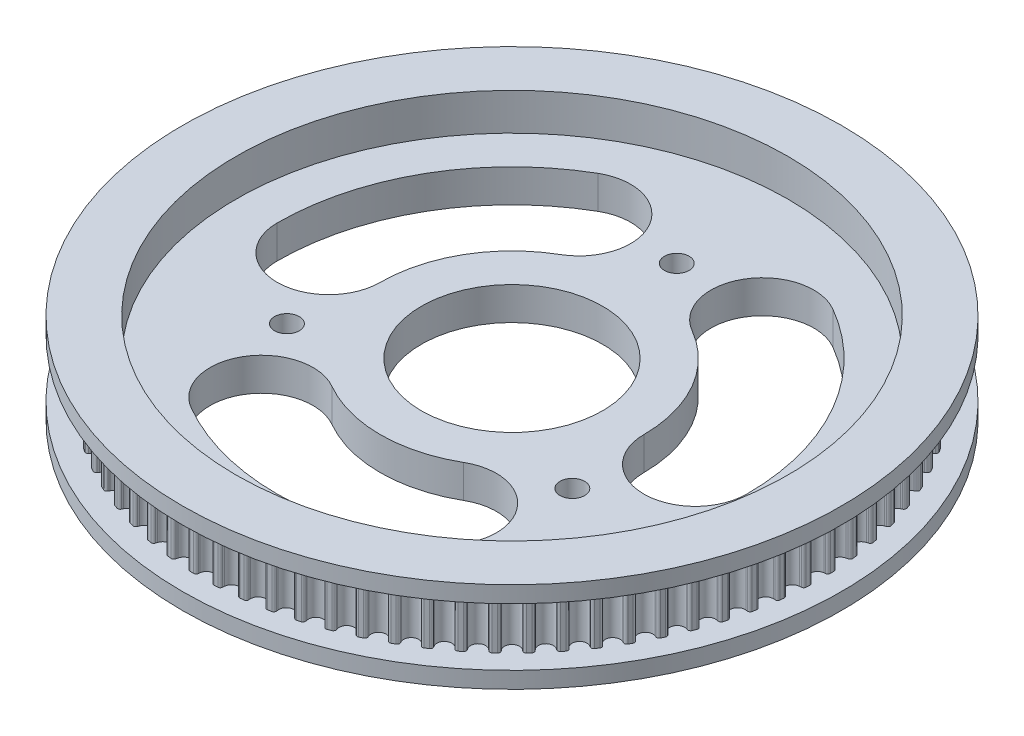
from build123d import *

# Parameters (mm, degrees)
SKETCH_1_R          = 40
EXTRUDE_1_DEPTH     = 5.5
SKETCH_2_OUTSIDE_W  = 104.734
SKETCH_2_OUTSIDE_H  = 104.734
CUT_EXTRUDE_1_DEPTH = 3.5
SKETCH_3_R          = 11
SKETCH_3_R_2        = 1.5
CUT_EXTRUDE_2_DEPTH = 58.628118137
CUT_EXTRUDE_START   = 2.5
SKETCH_4_R          = 33.5
SKETCH_4_R_2        = 11
CUT_EXTRUDE_3_DEPTH = 2.5
CUT_EXTRUDE_4_DEPTH = 58.203583804
SKETCH_6_R          = 33.5
CUT_EXTRUDE_5_DEPTH = 4.5


with BuildPart() as part:
    # 草图1 → 凸台-拉伸1 (new, symmetric)
    with BuildSketch(Plane(origin=(0, 0, 0), x_dir=(1, 0, 0), z_dir=(0, 1, 0))):
        with Locations(Location((0, 0, 0), (0, 0, 270))):
            Circle(SKETCH_1_R)
    extrude(amount=EXTRUDE_1_DEPTH, both=True)

    # 草图2 outside → 切除-拉伸1 (cut, symmetric)
    with BuildSketch(Plane(origin=(0, 0, 0), x_dir=(1, 0, 0), z_dir=(0, 1, 0))):
        Rectangle(SKETCH_2_OUTSIDE_W, SKETCH_2_OUTSIDE_H)
        with BuildLine():
            Line((-0.927435551, 37.150343182), (-0.903216998, 36.953098898))
            ThreePointArc((-0.903216998, 36.953098898), (0, 36.154), (0.903216998, 36.953098898))
            Line((0.903216998, 36.953098898), (0.927435551, 37.150343182))
            ThreePointArc((0.927435551, 37.150343182), (1.030147603, 37.34171833), (1.235097598, 37.413619043))
            ThreePointArc((1.235097598, 37.413619043), (1.469651943, 37.405139743), (1.704148514, 37.395189983))
            ThreePointArc((1.704148514, 37.395189983), (1.902825451, 37.307430724), (1.990205755, 37.108586826))
            Line((1.990205755, 37.108586826), (1.998874042, 36.910050415))
            ThreePointArc((1.998874042, 36.910050415), (2.836610147, 36.042549284), (3.799739405, 36.768319237))
            Line((3.799739405, 36.768319237), (3.839358909, 36.963055317))
            ThreePointArc((3.839358909, 36.963055317), (3.956769455, 37.145781825), (4.166728922, 37.201380701))
            ThreePointArc((4.166728922, 37.201380701), (4.399894936, 37.174524618), (4.632887983, 37.146207141))
            ThreePointArc((4.632887983, 37.146207141), (4.824066954, 37.043130401), (4.895576781, 36.838043694))
            Line((4.895576781, 36.838043694), (4.88864136, 36.639439198))
            ThreePointArc((4.88864136, 36.639439198), (5.655731649, 35.708884266), (6.672835156, 36.356850662))
            Line((6.672835156, 36.356850662), (6.727611342, 36.547877925))
            ThreePointArc((6.727611342, 36.547877925), (6.858996507, 36.720829223), (7.072670977, 36.759783477))
            ThreePointArc((7.072670977, 36.759783477), (7.303011114, 36.714716187), (7.533064158, 36.668205579))
            ThreePointArc((7.533064158, 36.668205579), (7.71556648, 36.550446862), (7.770764949, 36.340381772))
            Line((7.770764949, 36.340381772), (7.748268577, 36.142933654))
            ThreePointArc((7.748268577, 36.142933654), (8.439983685, 35.155062102), (9.504790658, 35.721230013))
            Line((9.504790658, 35.721230013), (9.574385814, 35.907370713))
            ThreePointArc((9.574385814, 35.907370713), (9.718935565, 36.069480498), (9.935007664, 36.091549963))
            ThreePointArc((9.935007664, 36.091549963), (10.1611018, 36.028549321), (10.386796487, 35.964132337))
            ThreePointArc((10.386796487, 35.964132337), (10.559496973, 35.832417663), (10.598043766, 35.618669312))
            Line((10.598043766, 35.618669312), (10.560125143, 35.423594906))
            ThreePointArc((10.560125143, 35.423594906), (11.172200415, 34.38449729), (12.278145966, 34.865376102))
            Line((12.278145966, 34.865376102), (12.362131014, 35.045482619))
            ThreePointArc((12.362131014, 35.045482619), (12.518954154, 35.195751431), (12.736091724, 35.200800042))
            ThreePointArc((12.736091724, 35.200800042), (12.956545915, 35.120254469), (13.176490761, 35.038328259))
            ThreePointArc((13.176490761, 35.038328259), (13.338324655, 34.893469694), (13.359982119, 34.677355911))
            Line((13.359982119, 34.677355911), (13.306875025, 34.485857915))
            ThreePointArc((13.306875025, 34.485857915), (13.835536814, 33.401940618), (14.97580242, 33.794565553))
            Line((14.97580242, 33.794565553), (15.073659565, 33.967527471))
            ThreePointArc((15.073659565, 33.967527471), (15.241789227, 34.105028853), (15.458653544, 34.093025483))
            ThreePointArc((15.458653544, 34.093025483), (15.672108615, 33.995431569), (15.884947589, 33.896501237))
            ThreePointArc((15.884947589, 33.896501237), (16.034917131, 33.739391881), (16.03955174, 33.52224508))
            Line((16.03955174, 33.52224508), (15.971583597, 33.335504143))
            ThreePointArc((15.971583597, 33.335504143), (16.413572528, 32.213449876), (17.581128073, 32.51540027))
            Line((17.581128073, 32.51540027), (17.692253993, 32.680151221))
            ThreePointArc((17.692253993, 32.680151221), (17.870653601, 32.804037431), (18.085907624, 32.775056085))
            ThreePointArc((18.085907624, 32.775056085), (18.291047554, 32.661015529), (18.495468432, 32.545691012))
            ThreePointArc((18.495468432, 32.545691012), (18.63264901, 32.377299498), (18.620232191, 32.16045846))
            Line((18.620232191, 32.16045846), (18.537822046, 31.979625902))
            ThreePointArc((18.537822046, 31.979625902), (18.890413109, 30.826352502), (20.078060225, 31.035766732))
            Line((20.078060225, 31.035766732), (20.201769792, 31.191290972))
            ThreePointArc((20.201769792, 31.191290972), (20.389339453, 31.30079821), (20.60165607, 31.255017568))
            ThreePointArc((20.60165607, 31.255017568), (20.797216103, 31.125233467), (20.991958562, 30.99422578))
            ThreePointArc((20.991958562, 30.99422578), (21.115504412, 30.815590297), (21.086112718, 30.60039192))
            Line((21.086112718, 30.60039192), (20.989768657, 30.426582634))
            ThreePointArc((20.989768657, 30.426582634), (21.250788011, 29.249200415), (22.451204459, 29.364787372))
            Line((22.451204459, 29.364787372), (22.586734961, 29.510126042))
            ThreePointArc((22.586734961, 29.510126042), (22.782318247, 29.604579159), (22.990388455, 29.542281474))
            ThreePointArc((22.990388455, 29.542281474), (23.175162898, 29.397553991), (23.359026287, 29.25167084))
            ThreePointArc((23.359026287, 29.25167084), (23.468175708, 29.063892734), (23.421990349, 28.851663788))
            Line((23.421990349, 28.851663788), (23.312306365, 28.685949366))
            ThreePointArc((23.312306365, 28.685949366), (23.480144739, 27.49171728), (24.685929552, 27.512764333))
            Line((24.685929552, 27.512764333), (24.8324454, 27.647021371))
            ThreePointArc((24.8324454, 27.647021371), (25.034836473, 27.725838034), (25.23737745, 27.647407391))
            ThreePointArc((25.23737745, 27.647407391), (25.410227108, 27.488628818), (25.582077847, 27.328769621))
            ThreePointArc((25.582077847, 27.328769621), (25.676157897, 27.133006608), (25.61346362, 26.925055554))
            Line((25.61346362, 26.925055554), (25.491115952, 26.76845768))
            ThreePointArc((25.491115952, 26.76845768), (25.564738567, 25.564738567), (26.76845768, 25.491115952))
            Line((26.76845768, 25.491115952), (26.925055554, 25.61346362))
            ThreePointArc((26.925055554, 25.61346362), (27.133006608, 25.676157897), (27.328769621, 25.582077847))
            ThreePointArc((27.328769621, 25.582077847), (27.488628818, 25.410227108), (27.647407391, 25.23737745))
            ThreePointArc((27.647407391, 25.23737745), (27.725838034, 25.034836473), (27.647021371, 24.8324454))
            Line((27.647021371, 24.8324454), (27.512764333, 24.685929552))
            ThreePointArc((27.512764333, 24.685929552), (27.49171728, 23.480144739), (28.685949366, 23.312306365))
            Line((28.685949366, 23.312306365), (28.851663788, 23.421990349))
            ThreePointArc((28.851663788, 23.421990349), (29.063892734, 23.468175708), (29.25167084, 23.359026287))
            ThreePointArc((29.25167084, 23.359026287), (29.397553991, 23.175162898), (29.542281474, 22.990388455))
            ThreePointArc((29.542281474, 22.990388455), (29.604579159, 22.782318247), (29.510126042, 22.586734961))
            Line((29.510126042, 22.586734961), (29.364787372, 22.451204459))
            ThreePointArc((29.364787372, 22.451204459), (29.249200415, 21.250788011), (30.426582634, 20.989768657))
            Line((30.426582634, 20.989768657), (30.60039192, 21.086112718))
            ThreePointArc((30.60039192, 21.086112718), (30.815590297, 21.115504412), (30.99422578, 20.991958562))
            ThreePointArc((30.99422578, 20.991958562), (31.125233467, 20.797216103), (31.255017568, 20.60165607))
            ThreePointArc((31.255017568, 20.60165607), (31.30079821, 20.389339453), (31.191290972, 20.201769792))
            Line((31.191290972, 20.201769792), (31.035766732, 20.078060225))
            ThreePointArc((31.035766732, 20.078060225), (30.826352502, 18.890413109), (31.979625902, 18.537822046))
            Line((31.979625902, 18.537822046), (32.16045846, 18.620232191))
            ThreePointArc((32.16045846, 18.620232191), (32.377299498, 18.63264901), (32.545691012, 18.495468432))
            ThreePointArc((32.545691012, 18.495468432), (32.661015529, 18.291047554), (32.775056085, 18.085907624))
            ThreePointArc((32.775056085, 18.085907624), (32.804037431, 17.870653601), (32.680151221, 17.692253993))
            Line((32.680151221, 17.692253993), (32.51540027, 17.581128073))
            ThreePointArc((32.51540027, 17.581128073), (32.213449876, 16.413572528), (33.335504143, 15.971583597))
            Line((33.335504143, 15.971583597), (33.52224508, 16.03955174))
            ThreePointArc((33.52224508, 16.03955174), (33.739391881, 16.034917131), (33.896501237, 15.884947589))
            ThreePointArc((33.896501237, 15.884947589), (33.995431569, 15.672108615), (34.093025483, 15.458653544))
            ThreePointArc((34.093025483, 15.458653544), (34.105028853, 15.241789227), (33.967527471, 15.073659565))
            Line((33.967527471, 15.073659565), (33.794565553, 14.97580242))
            ThreePointArc((33.794565553, 14.97580242), (33.401940618, 13.835536814), (34.485857915, 13.306875025))
            Line((34.485857915, 13.306875025), (34.677355911, 13.359982119))
            ThreePointArc((34.677355911, 13.359982119), (34.893469694, 13.338324655), (35.038328259, 13.176490761))
            ThreePointArc((35.038328259, 13.176490761), (35.120254469, 12.956545915), (35.200800042, 12.736091724))
            ThreePointArc((35.200800042, 12.736091724), (35.195751431, 12.518954154), (35.045482619, 12.362131014))
            Line((35.045482619, 12.362131014), (34.865376102, 12.278145966))
            ThreePointArc((34.865376102, 12.278145966), (34.38449729, 11.172200415), (35.423594906, 10.560125143))
            Line((35.423594906, 10.560125143), (35.618669312, 10.598043766))
            ThreePointArc((35.618669312, 10.598043766), (35.832417663, 10.559496973), (35.964132337, 10.386796487))
            ThreePointArc((35.964132337, 10.386796487), (36.028549321, 10.1611018), (36.091549963, 9.935007664))
            ThreePointArc((36.091549963, 9.935007664), (36.069480498, 9.718935565), (35.907370713, 9.574385814))
            Line((35.907370713, 9.574385814), (35.721230013, 9.504790658))
            ThreePointArc((35.721230013, 9.504790658), (35.155062102, 8.439983685), (36.142933654, 7.748268577))
            Line((36.142933654, 7.748268577), (36.340381772, 7.770764949))
            ThreePointArc((36.340381772, 7.770764949), (36.550446862, 7.71556648), (36.668205579, 7.533064158))
            ThreePointArc((36.668205579, 7.533064158), (36.714716187, 7.303011114), (36.759783477, 7.072670977))
            ThreePointArc((36.759783477, 7.072670977), (36.720829223, 6.858996507), (36.547877925, 6.727611342))
            Line((36.547877925, 6.727611342), (36.356850662, 6.672835156))
            ThreePointArc((36.356850662, 6.672835156), (35.708884266, 5.655731649), (36.639439198, 4.88864136))
            Line((36.639439198, 4.88864136), (36.838043694, 4.895576781))
            ThreePointArc((36.838043694, 4.895576781), (37.043130401, 4.824066954), (37.146207141, 4.632887983))
            ThreePointArc((37.146207141, 4.632887983), (37.174524618, 4.399894936), (37.201380701, 4.166728922))
            ThreePointArc((37.201380701, 4.166728922), (37.145781825, 3.956769455), (36.963055317, 3.839358909))
            Line((36.963055317, 3.839358909), (36.768319237, 3.799739405))
            ThreePointArc((36.768319237, 3.799739405), (36.042549284, 2.836610147), (36.910050415, 1.998874042))
            Line((36.910050415, 1.998874042), (37.108586826, 1.990205755))
            ThreePointArc((37.108586826, 1.990205755), (37.307430724, 1.902825451), (37.395189983, 1.704148514))
            ThreePointArc((37.395189983, 1.704148514), (37.405139743, 1.469651943), (37.413619043, 1.235097598))
            ThreePointArc((37.413619043, 1.235097598), (37.34171833, 1.030147603), (37.150343182, 0.927435551))
            Line((37.150343182, 0.927435551), (36.953098898, 0.903216998))
            ThreePointArc((36.953098898, 0.903216998), (36.154, 0), (36.953098898, -0.903216998))
            Line((36.953098898, -0.903216998), (37.150343182, -0.927435551))
            ThreePointArc((37.150343182, -0.927435551), (37.34171833, -1.030147603), (37.413619043, -1.235097598))
            ThreePointArc((37.413619043, -1.235097598), (37.405139743, -1.469651943), (37.395189983, -1.704148514))
            ThreePointArc((37.395189983, -1.704148514), (37.307430724, -1.902825451), (37.108586826, -1.990205755))
            Line((37.108586826, -1.990205755), (36.910050415, -1.998874042))
            ThreePointArc((36.910050415, -1.998874042), (36.042549284, -2.836610147), (36.768319237, -3.799739405))
            Line((36.768319237, -3.799739405), (36.963055317, -3.839358909))
            ThreePointArc((36.963055317, -3.839358909), (37.145781825, -3.956769455), (37.201380701, -4.166728922))
            ThreePointArc((37.201380701, -4.166728922), (37.174524618, -4.399894936), (37.146207141, -4.632887983))
            ThreePointArc((37.146207141, -4.632887983), (37.043130401, -4.824066954), (36.838043694, -4.895576781))
            Line((36.838043694, -4.895576781), (36.639439198, -4.88864136))
            ThreePointArc((36.639439198, -4.88864136), (35.708884266, -5.655731649), (36.356850662, -6.672835156))
            Line((36.356850662, -6.672835156), (36.547877925, -6.727611342))
            ThreePointArc((36.547877925, -6.727611342), (36.720829223, -6.858996507), (36.759783477, -7.072670977))
            ThreePointArc((36.759783477, -7.072670977), (36.714716187, -7.303011114), (36.668205579, -7.533064158))
            ThreePointArc((36.668205579, -7.533064158), (36.550446862, -7.71556648), (36.340381772, -7.770764949))
            Line((36.340381772, -7.770764949), (36.142933654, -7.748268577))
            ThreePointArc((36.142933654, -7.748268577), (35.155062102, -8.439983685), (35.721230013, -9.504790658))
            Line((35.721230013, -9.504790658), (35.907370713, -9.574385814))
            ThreePointArc((35.907370713, -9.574385814), (36.069480498, -9.718935565), (36.091549963, -9.935007664))
            ThreePointArc((36.091549963, -9.935007664), (36.028549321, -10.1611018), (35.964132337, -10.386796487))
            ThreePointArc((35.964132337, -10.386796487), (35.832417663, -10.559496973), (35.618669312, -10.598043766))
            Line((35.618669312, -10.598043766), (35.423594906, -10.560125143))
            ThreePointArc((35.423594906, -10.560125143), (34.38449729, -11.172200415), (34.865376102, -12.278145966))
            Line((34.865376102, -12.278145966), (35.045482619, -12.362131014))
            ThreePointArc((35.045482619, -12.362131014), (35.195751431, -12.518954154), (35.200800042, -12.736091724))
            ThreePointArc((35.200800042, -12.736091724), (35.120254469, -12.956545915), (35.038328259, -13.176490761))
            ThreePointArc((35.038328259, -13.176490761), (34.893469694, -13.338324655), (34.677355911, -13.359982119))
            Line((34.677355911, -13.359982119), (34.485857915, -13.306875025))
            ThreePointArc((34.485857915, -13.306875025), (33.401940618, -13.835536814), (33.794565553, -14.97580242))
            Line((33.794565553, -14.97580242), (33.967527471, -15.073659565))
            ThreePointArc((33.967527471, -15.073659565), (34.105028853, -15.241789227), (34.093025483, -15.458653544))
            ThreePointArc((34.093025483, -15.458653544), (33.995431569, -15.672108615), (33.896501237, -15.884947589))
            ThreePointArc((33.896501237, -15.884947589), (33.739391881, -16.034917131), (33.52224508, -16.03955174))
            Line((33.52224508, -16.03955174), (33.335504143, -15.971583597))
            ThreePointArc((33.335504143, -15.971583597), (32.213449876, -16.413572528), (32.51540027, -17.581128073))
            Line((32.51540027, -17.581128073), (32.680151221, -17.692253993))
            ThreePointArc((32.680151221, -17.692253993), (32.804037431, -17.870653601), (32.775056085, -18.085907624))
            ThreePointArc((32.775056085, -18.085907624), (32.661015529, -18.291047554), (32.545691012, -18.495468432))
            ThreePointArc((32.545691012, -18.495468432), (32.377299498, -18.63264901), (32.16045846, -18.620232191))
            Line((32.16045846, -18.620232191), (31.979625902, -18.537822046))
            ThreePointArc((31.979625902, -18.537822046), (30.826352502, -18.890413109), (31.035766732, -20.078060225))
            Line((31.035766732, -20.078060225), (31.191290972, -20.201769792))
            ThreePointArc((31.191290972, -20.201769792), (31.30079821, -20.389339453), (31.255017568, -20.60165607))
            ThreePointArc((31.255017568, -20.60165607), (31.125233467, -20.797216103), (30.99422578, -20.991958562))
            ThreePointArc((30.99422578, -20.991958562), (30.815590297, -21.115504412), (30.60039192, -21.086112718))
            Line((30.60039192, -21.086112718), (30.426582634, -20.989768657))
            ThreePointArc((30.426582634, -20.989768657), (29.249200415, -21.250788011), (29.364787372, -22.451204459))
            Line((29.364787372, -22.451204459), (29.510126042, -22.586734961))
            ThreePointArc((29.510126042, -22.586734961), (29.604579159, -22.782318247), (29.542281474, -22.990388455))
            ThreePointArc((29.542281474, -22.990388455), (29.397553991, -23.175162898), (29.25167084, -23.359026287))
            ThreePointArc((29.25167084, -23.359026287), (29.063892734, -23.468175708), (28.851663788, -23.421990349))
            Line((28.851663788, -23.421990349), (28.685949366, -23.312306365))
            ThreePointArc((28.685949366, -23.312306365), (27.49171728, -23.480144739), (27.512764333, -24.685929552))
            Line((27.512764333, -24.685929552), (27.647021371, -24.8324454))
            ThreePointArc((27.647021371, -24.8324454), (27.725838034, -25.034836473), (27.647407391, -25.23737745))
            ThreePointArc((27.647407391, -25.23737745), (27.488628818, -25.410227108), (27.328769621, -25.582077847))
            ThreePointArc((27.328769621, -25.582077847), (27.133006608, -25.676157897), (26.925055554, -25.61346362))
            Line((26.925055554, -25.61346362), (26.76845768, -25.491115952))
            ThreePointArc((26.76845768, -25.491115952), (25.564738567, -25.564738567), (25.491115952, -26.76845768))
            Line((25.491115952, -26.76845768), (25.61346362, -26.925055554))
            ThreePointArc((25.61346362, -26.925055554), (25.676157897, -27.133006608), (25.582077847, -27.328769621))
            ThreePointArc((25.582077847, -27.328769621), (25.410227108, -27.488628818), (25.23737745, -27.647407391))
            ThreePointArc((25.23737745, -27.647407391), (25.034836473, -27.725838034), (24.8324454, -27.647021371))
            Line((24.8324454, -27.647021371), (24.685929552, -27.512764333))
            ThreePointArc((24.685929552, -27.512764333), (23.480144739, -27.49171728), (23.312306365, -28.685949366))
            Line((23.312306365, -28.685949366), (23.421990349, -28.851663788))
            ThreePointArc((23.421990349, -28.851663788), (23.468175708, -29.063892734), (23.359026287, -29.25167084))
            ThreePointArc((23.359026287, -29.25167084), (23.175162898, -29.397553991), (22.990388455, -29.542281474))
            ThreePointArc((22.990388455, -29.542281474), (22.782318247, -29.604579159), (22.586734961, -29.510126042))
            Line((22.586734961, -29.510126042), (22.451204459, -29.364787372))
            ThreePointArc((22.451204459, -29.364787372), (21.250788011, -29.249200415), (20.989768657, -30.426582634))
            Line((20.989768657, -30.426582634), (21.086112718, -30.60039192))
            ThreePointArc((21.086112718, -30.60039192), (21.115504412, -30.815590297), (20.991958562, -30.99422578))
            ThreePointArc((20.991958562, -30.99422578), (20.797216103, -31.125233467), (20.60165607, -31.255017568))
            ThreePointArc((20.60165607, -31.255017568), (20.389339453, -31.30079821), (20.201769792, -31.191290972))
            Line((20.201769792, -31.191290972), (20.078060225, -31.035766732))
            ThreePointArc((20.078060225, -31.035766732), (18.890413109, -30.826352502), (18.537822046, -31.979625902))
            Line((18.537822046, -31.979625902), (18.620232191, -32.16045846))
            ThreePointArc((18.620232191, -32.16045846), (18.63264901, -32.377299498), (18.495468432, -32.545691012))
            ThreePointArc((18.495468432, -32.545691012), (18.291047554, -32.661015529), (18.085907624, -32.775056085))
            ThreePointArc((18.085907624, -32.775056085), (17.870653601, -32.804037431), (17.692253993, -32.680151221))
            Line((17.692253993, -32.680151221), (17.581128073, -32.51540027))
            ThreePointArc((17.581128073, -32.51540027), (16.413572528, -32.213449876), (15.971583597, -33.335504143))
            Line((15.971583597, -33.335504143), (16.03955174, -33.52224508))
            ThreePointArc((16.03955174, -33.52224508), (16.034917131, -33.739391881), (15.884947589, -33.896501237))
            ThreePointArc((15.884947589, -33.896501237), (15.672108615, -33.995431569), (15.458653544, -34.093025483))
            ThreePointArc((15.458653544, -34.093025483), (15.241789227, -34.105028853), (15.073659565, -33.967527471))
            Line((15.073659565, -33.967527471), (14.97580242, -33.794565553))
            ThreePointArc((14.97580242, -33.794565553), (13.835536814, -33.401940618), (13.306875025, -34.485857915))
            Line((13.306875025, -34.485857915), (13.359982119, -34.677355911))
            ThreePointArc((13.359982119, -34.677355911), (13.338324655, -34.893469694), (13.176490761, -35.038328259))
            ThreePointArc((13.176490761, -35.038328259), (12.956545915, -35.120254469), (12.736091724, -35.200800042))
            ThreePointArc((12.736091724, -35.200800042), (12.518954154, -35.195751431), (12.362131014, -35.045482619))
            Line((12.362131014, -35.045482619), (12.278145966, -34.865376102))
            ThreePointArc((12.278145966, -34.865376102), (11.172200415, -34.38449729), (10.560125143, -35.423594906))
            Line((10.560125143, -35.423594906), (10.598043766, -35.618669312))
            ThreePointArc((10.598043766, -35.618669312), (10.559496973, -35.832417663), (10.386796487, -35.964132337))
            ThreePointArc((10.386796487, -35.964132337), (10.1611018, -36.028549321), (9.935007664, -36.091549963))
            ThreePointArc((9.935007664, -36.091549963), (9.718935565, -36.069480498), (9.574385814, -35.907370713))
            Line((9.574385814, -35.907370713), (9.504790658, -35.721230013))
            ThreePointArc((9.504790658, -35.721230013), (8.439983685, -35.155062102), (7.748268577, -36.142933654))
            Line((7.748268577, -36.142933654), (7.770764949, -36.340381772))
            ThreePointArc((7.770764949, -36.340381772), (7.71556648, -36.550446862), (7.533064158, -36.668205579))
            ThreePointArc((7.533064158, -36.668205579), (7.303011114, -36.714716187), (7.072670977, -36.759783477))
            ThreePointArc((7.072670977, -36.759783477), (6.858996507, -36.720829223), (6.727611342, -36.547877925))
            Line((6.727611342, -36.547877925), (6.672835156, -36.356850662))
            ThreePointArc((6.672835156, -36.356850662), (5.655731649, -35.708884266), (4.88864136, -36.639439198))
            Line((4.88864136, -36.639439198), (4.895576781, -36.838043694))
            ThreePointArc((4.895576781, -36.838043694), (4.824066954, -37.043130401), (4.632887983, -37.146207141))
            ThreePointArc((4.632887983, -37.146207141), (4.399894936, -37.174524618), (4.166728922, -37.201380701))
            ThreePointArc((4.166728922, -37.201380701), (3.956769455, -37.145781825), (3.839358909, -36.963055317))
            Line((3.839358909, -36.963055317), (3.799739405, -36.768319237))
            ThreePointArc((3.799739405, -36.768319237), (2.836610147, -36.042549284), (1.998874042, -36.910050415))
            Line((1.998874042, -36.910050415), (1.990205755, -37.108586826))
            ThreePointArc((1.990205755, -37.108586826), (1.902825451, -37.307430724), (1.704148514, -37.395189983))
            ThreePointArc((1.704148514, -37.395189983), (1.469651943, -37.405139743), (1.235097598, -37.413619043))
            ThreePointArc((1.235097598, -37.413619043), (1.030147603, -37.34171833), (0.927435551, -37.150343182))
            Line((0.927435551, -37.150343182), (0.903216998, -36.953098898))
            ThreePointArc((0.903216998, -36.953098898), (0, -36.154), (-0.903216998, -36.953098898))
            Line((-0.903216998, -36.953098898), (-0.927435551, -37.150343182))
            ThreePointArc((-0.927435551, -37.150343182), (-1.030147603, -37.34171833), (-1.235097598, -37.413619043))
            ThreePointArc((-1.235097598, -37.413619043), (-1.469651943, -37.405139743), (-1.704148514, -37.395189983))
            ThreePointArc((-1.704148514, -37.395189983), (-1.902825451, -37.307430724), (-1.990205755, -37.108586826))
            Line((-1.990205755, -37.108586826), (-1.998874042, -36.910050415))
            ThreePointArc((-1.998874042, -36.910050415), (-2.836610147, -36.042549284), (-3.799739405, -36.768319237))
            Line((-3.799739405, -36.768319237), (-3.839358909, -36.963055317))
            ThreePointArc((-3.839358909, -36.963055317), (-3.956769455, -37.145781825), (-4.166728922, -37.201380701))
            ThreePointArc((-4.166728922, -37.201380701), (-4.399894936, -37.174524618), (-4.632887983, -37.146207141))
            ThreePointArc((-4.632887983, -37.146207141), (-4.824066954, -37.043130401), (-4.895576781, -36.838043694))
            Line((-4.895576781, -36.838043694), (-4.88864136, -36.639439198))
            ThreePointArc((-4.88864136, -36.639439198), (-5.655731649, -35.708884266), (-6.672835156, -36.356850662))
            Line((-6.672835156, -36.356850662), (-6.727611342, -36.547877925))
            ThreePointArc((-6.727611342, -36.547877925), (-6.858996507, -36.720829223), (-7.072670977, -36.759783477))
            ThreePointArc((-7.072670977, -36.759783477), (-7.303011114, -36.714716187), (-7.533064158, -36.668205579))
            ThreePointArc((-7.533064158, -36.668205579), (-7.71556648, -36.550446862), (-7.770764949, -36.340381772))
            Line((-7.770764949, -36.340381772), (-7.748268577, -36.142933654))
            ThreePointArc((-7.748268577, -36.142933654), (-8.439983685, -35.155062102), (-9.504790658, -35.721230013))
            Line((-9.504790658, -35.721230013), (-9.574385814, -35.907370713))
            ThreePointArc((-9.574385814, -35.907370713), (-9.718935565, -36.069480498), (-9.935007664, -36.091549963))
            ThreePointArc((-9.935007664, -36.091549963), (-10.1611018, -36.028549321), (-10.386796487, -35.964132337))
            ThreePointArc((-10.386796487, -35.964132337), (-10.559496973, -35.832417663), (-10.598043766, -35.618669312))
            Line((-10.598043766, -35.618669312), (-10.560125143, -35.423594906))
            ThreePointArc((-10.560125143, -35.423594906), (-11.172200415, -34.38449729), (-12.278145966, -34.865376102))
            Line((-12.278145966, -34.865376102), (-12.362131014, -35.045482619))
            ThreePointArc((-12.362131014, -35.045482619), (-12.518954154, -35.195751431), (-12.736091724, -35.200800042))
            ThreePointArc((-12.736091724, -35.200800042), (-12.956545915, -35.120254469), (-13.176490761, -35.038328259))
            ThreePointArc((-13.176490761, -35.038328259), (-13.338324655, -34.893469694), (-13.359982119, -34.677355911))
            Line((-13.359982119, -34.677355911), (-13.306875025, -34.485857915))
            ThreePointArc((-13.306875025, -34.485857915), (-13.835536814, -33.401940618), (-14.97580242, -33.794565553))
            Line((-14.97580242, -33.794565553), (-15.073659565, -33.967527471))
            ThreePointArc((-15.073659565, -33.967527471), (-15.241789227, -34.105028853), (-15.458653544, -34.093025483))
            ThreePointArc((-15.458653544, -34.093025483), (-15.672108615, -33.995431569), (-15.884947589, -33.896501237))
            ThreePointArc((-15.884947589, -33.896501237), (-16.034917131, -33.739391881), (-16.03955174, -33.52224508))
            Line((-16.03955174, -33.52224508), (-15.971583597, -33.335504143))
            ThreePointArc((-15.971583597, -33.335504143), (-16.413572528, -32.213449876), (-17.581128073, -32.51540027))
            Line((-17.581128073, -32.51540027), (-17.692253993, -32.680151221))
            ThreePointArc((-17.692253993, -32.680151221), (-17.870653601, -32.804037431), (-18.085907624, -32.775056085))
            ThreePointArc((-18.085907624, -32.775056085), (-18.291047554, -32.661015529), (-18.495468432, -32.545691012))
            ThreePointArc((-18.495468432, -32.545691012), (-18.63264901, -32.377299498), (-18.620232191, -32.16045846))
            Line((-18.620232191, -32.16045846), (-18.537822046, -31.979625902))
            ThreePointArc((-18.537822046, -31.979625902), (-18.890413109, -30.826352502), (-20.078060225, -31.035766732))
            Line((-20.078060225, -31.035766732), (-20.201769792, -31.191290972))
            ThreePointArc((-20.201769792, -31.191290972), (-20.389339453, -31.30079821), (-20.60165607, -31.255017568))
            ThreePointArc((-20.60165607, -31.255017568), (-20.797216103, -31.125233467), (-20.991958562, -30.99422578))
            ThreePointArc((-20.991958562, -30.99422578), (-21.115504412, -30.815590297), (-21.086112718, -30.60039192))
            Line((-21.086112718, -30.60039192), (-20.989768657, -30.426582634))
            ThreePointArc((-20.989768657, -30.426582634), (-21.250788011, -29.249200415), (-22.451204459, -29.364787372))
            Line((-22.451204459, -29.364787372), (-22.586734961, -29.510126042))
            ThreePointArc((-22.586734961, -29.510126042), (-22.782318247, -29.604579159), (-22.990388455, -29.542281474))
            ThreePointArc((-22.990388455, -29.542281474), (-23.175162898, -29.397553991), (-23.359026287, -29.25167084))
            ThreePointArc((-23.359026287, -29.25167084), (-23.468175708, -29.063892734), (-23.421990349, -28.851663788))
            Line((-23.421990349, -28.851663788), (-23.312306365, -28.685949366))
            ThreePointArc((-23.312306365, -28.685949366), (-23.480144739, -27.49171728), (-24.685929552, -27.512764333))
            Line((-24.685929552, -27.512764333), (-24.8324454, -27.647021371))
            ThreePointArc((-24.8324454, -27.647021371), (-25.034836473, -27.725838034), (-25.23737745, -27.647407391))
            ThreePointArc((-25.23737745, -27.647407391), (-25.410227108, -27.488628818), (-25.582077847, -27.328769621))
            ThreePointArc((-25.582077847, -27.328769621), (-25.676157897, -27.133006608), (-25.61346362, -26.925055554))
            Line((-25.61346362, -26.925055554), (-25.491115952, -26.76845768))
            ThreePointArc((-25.491115952, -26.76845768), (-25.564738567, -25.564738567), (-26.76845768, -25.491115952))
            Line((-26.76845768, -25.491115952), (-26.925055554, -25.61346362))
            ThreePointArc((-26.925055554, -25.61346362), (-27.133006608, -25.676157897), (-27.328769621, -25.582077847))
            ThreePointArc((-27.328769621, -25.582077847), (-27.488628818, -25.410227108), (-27.647407391, -25.23737745))
            ThreePointArc((-27.647407391, -25.23737745), (-27.725838034, -25.034836473), (-27.647021371, -24.8324454))
            Line((-27.647021371, -24.8324454), (-27.512764333, -24.685929552))
            ThreePointArc((-27.512764333, -24.685929552), (-27.49171728, -23.480144739), (-28.685949366, -23.312306365))
            Line((-28.685949366, -23.312306365), (-28.851663788, -23.421990349))
            ThreePointArc((-28.851663788, -23.421990349), (-29.063892734, -23.468175708), (-29.25167084, -23.359026287))
            ThreePointArc((-29.25167084, -23.359026287), (-29.397553991, -23.175162898), (-29.542281474, -22.990388455))
            ThreePointArc((-29.542281474, -22.990388455), (-29.604579159, -22.782318247), (-29.510126042, -22.586734961))
            Line((-29.510126042, -22.586734961), (-29.364787372, -22.451204459))
            ThreePointArc((-29.364787372, -22.451204459), (-29.249200415, -21.250788011), (-30.426582634, -20.989768657))
            Line((-30.426582634, -20.989768657), (-30.60039192, -21.086112718))
            ThreePointArc((-30.60039192, -21.086112718), (-30.815590297, -21.115504412), (-30.99422578, -20.991958562))
            ThreePointArc((-30.99422578, -20.991958562), (-31.125233467, -20.797216103), (-31.255017568, -20.60165607))
            ThreePointArc((-31.255017568, -20.60165607), (-31.30079821, -20.389339453), (-31.191290972, -20.201769792))
            Line((-31.191290972, -20.201769792), (-31.035766732, -20.078060225))
            ThreePointArc((-31.035766732, -20.078060225), (-30.826352502, -18.890413109), (-31.979625902, -18.537822046))
            Line((-31.979625902, -18.537822046), (-32.16045846, -18.620232191))
            ThreePointArc((-32.16045846, -18.620232191), (-32.377299498, -18.63264901), (-32.545691012, -18.495468432))
            ThreePointArc((-32.545691012, -18.495468432), (-32.661015529, -18.291047554), (-32.775056085, -18.085907624))
            ThreePointArc((-32.775056085, -18.085907624), (-32.804037431, -17.870653601), (-32.680151221, -17.692253993))
            Line((-32.680151221, -17.692253993), (-32.51540027, -17.581128073))
            ThreePointArc((-32.51540027, -17.581128073), (-32.213449876, -16.413572528), (-33.335504143, -15.971583597))
            Line((-33.335504143, -15.971583597), (-33.52224508, -16.03955174))
            ThreePointArc((-33.52224508, -16.03955174), (-33.739391881, -16.034917131), (-33.896501237, -15.884947589))
            ThreePointArc((-33.896501237, -15.884947589), (-33.995431569, -15.672108615), (-34.093025483, -15.458653544))
            ThreePointArc((-34.093025483, -15.458653544), (-34.105028853, -15.241789227), (-33.967527471, -15.073659565))
            Line((-33.967527471, -15.073659565), (-33.794565553, -14.97580242))
            ThreePointArc((-33.794565553, -14.97580242), (-33.401940618, -13.835536814), (-34.485857915, -13.306875025))
            Line((-34.485857915, -13.306875025), (-34.677355911, -13.359982119))
            ThreePointArc((-34.677355911, -13.359982119), (-34.893469694, -13.338324655), (-35.038328259, -13.176490761))
            ThreePointArc((-35.038328259, -13.176490761), (-35.120254469, -12.956545915), (-35.200800042, -12.736091724))
            ThreePointArc((-35.200800042, -12.736091724), (-35.195751431, -12.518954154), (-35.045482619, -12.362131014))
            Line((-35.045482619, -12.362131014), (-34.865376102, -12.278145966))
            ThreePointArc((-34.865376102, -12.278145966), (-34.38449729, -11.172200415), (-35.423594906, -10.560125143))
            Line((-35.423594906, -10.560125143), (-35.618669312, -10.598043766))
            ThreePointArc((-35.618669312, -10.598043766), (-35.832417663, -10.559496973), (-35.964132337, -10.386796487))
            ThreePointArc((-35.964132337, -10.386796487), (-36.028549321, -10.1611018), (-36.091549963, -9.935007664))
            ThreePointArc((-36.091549963, -9.935007664), (-36.069480498, -9.718935565), (-35.907370713, -9.574385814))
            Line((-35.907370713, -9.574385814), (-35.721230013, -9.504790658))
            ThreePointArc((-35.721230013, -9.504790658), (-35.155062102, -8.439983685), (-36.142933654, -7.748268577))
            Line((-36.142933654, -7.748268577), (-36.340381772, -7.770764949))
            ThreePointArc((-36.340381772, -7.770764949), (-36.550446862, -7.71556648), (-36.668205579, -7.533064158))
            ThreePointArc((-36.668205579, -7.533064158), (-36.714716187, -7.303011114), (-36.759783477, -7.072670977))
            ThreePointArc((-36.759783477, -7.072670977), (-36.720829223, -6.858996507), (-36.547877925, -6.727611342))
            Line((-36.547877925, -6.727611342), (-36.356850662, -6.672835156))
            ThreePointArc((-36.356850662, -6.672835156), (-35.708884266, -5.655731649), (-36.639439198, -4.88864136))
            Line((-36.639439198, -4.88864136), (-36.838043694, -4.895576781))
            ThreePointArc((-36.838043694, -4.895576781), (-37.043130401, -4.824066954), (-37.146207141, -4.632887983))
            ThreePointArc((-37.146207141, -4.632887983), (-37.174524618, -4.399894936), (-37.201380701, -4.166728922))
            ThreePointArc((-37.201380701, -4.166728922), (-37.145781825, -3.956769455), (-36.963055317, -3.839358909))
            Line((-36.963055317, -3.839358909), (-36.768319237, -3.799739405))
            ThreePointArc((-36.768319237, -3.799739405), (-36.042549284, -2.836610147), (-36.910050415, -1.998874042))
            Line((-36.910050415, -1.998874042), (-37.108586826, -1.990205755))
            ThreePointArc((-37.108586826, -1.990205755), (-37.307430724, -1.902825451), (-37.395189983, -1.704148514))
            ThreePointArc((-37.395189983, -1.704148514), (-37.405139743, -1.469651943), (-37.413619043, -1.235097598))
            ThreePointArc((-37.413619043, -1.235097598), (-37.34171833, -1.030147603), (-37.150343182, -0.927435551))
            Line((-37.150343182, -0.927435551), (-36.953098898, -0.903216998))
            ThreePointArc((-36.953098898, -0.903216998), (-36.154, 0), (-36.953098898, 0.903216998))
            Line((-36.953098898, 0.903216998), (-37.150343182, 0.927435551))
            ThreePointArc((-37.150343182, 0.927435551), (-37.34171833, 1.030147603), (-37.413619043, 1.235097598))
            ThreePointArc((-37.413619043, 1.235097598), (-37.405139743, 1.469651943), (-37.395189983, 1.704148514))
            ThreePointArc((-37.395189983, 1.704148514), (-37.307430724, 1.902825451), (-37.108586826, 1.990205755))
            Line((-37.108586826, 1.990205755), (-36.910050415, 1.998874042))
            ThreePointArc((-36.910050415, 1.998874042), (-36.042549284, 2.836610147), (-36.768319237, 3.799739405))
            Line((-36.768319237, 3.799739405), (-36.963055317, 3.839358909))
            ThreePointArc((-36.963055317, 3.839358909), (-37.145781825, 3.956769455), (-37.201380701, 4.166728922))
            ThreePointArc((-37.201380701, 4.166728922), (-37.174524618, 4.399894936), (-37.146207141, 4.632887983))
            ThreePointArc((-37.146207141, 4.632887983), (-37.043130401, 4.824066954), (-36.838043694, 4.895576781))
            Line((-36.838043694, 4.895576781), (-36.639439198, 4.88864136))
            ThreePointArc((-36.639439198, 4.88864136), (-35.708884266, 5.655731649), (-36.356850662, 6.672835156))
            Line((-36.356850662, 6.672835156), (-36.547877925, 6.727611342))
            ThreePointArc((-36.547877925, 6.727611342), (-36.720829223, 6.858996507), (-36.759783477, 7.072670977))
            ThreePointArc((-36.759783477, 7.072670977), (-36.714716187, 7.303011114), (-36.668205579, 7.533064158))
            ThreePointArc((-36.668205579, 7.533064158), (-36.550446862, 7.71556648), (-36.340381772, 7.770764949))
            Line((-36.340381772, 7.770764949), (-36.142933654, 7.748268577))
            ThreePointArc((-36.142933654, 7.748268577), (-35.155062102, 8.439983685), (-35.721230013, 9.504790658))
            Line((-35.721230013, 9.504790658), (-35.907370713, 9.574385814))
            ThreePointArc((-35.907370713, 9.574385814), (-36.069480498, 9.718935565), (-36.091549963, 9.935007664))
            ThreePointArc((-36.091549963, 9.935007664), (-36.028549321, 10.1611018), (-35.964132337, 10.386796487))
            ThreePointArc((-35.964132337, 10.386796487), (-35.832417663, 10.559496973), (-35.618669312, 10.598043766))
            Line((-35.618669312, 10.598043766), (-35.423594906, 10.560125143))
            ThreePointArc((-35.423594906, 10.560125143), (-34.38449729, 11.172200415), (-34.865376102, 12.278145966))
            Line((-34.865376102, 12.278145966), (-35.045482619, 12.362131014))
            ThreePointArc((-35.045482619, 12.362131014), (-35.195751431, 12.518954154), (-35.200800042, 12.736091724))
            ThreePointArc((-35.200800042, 12.736091724), (-35.120254469, 12.956545915), (-35.038328259, 13.176490761))
            ThreePointArc((-35.038328259, 13.176490761), (-34.893469694, 13.338324655), (-34.677355911, 13.359982119))
            Line((-34.677355911, 13.359982119), (-34.485857915, 13.306875025))
            ThreePointArc((-34.485857915, 13.306875025), (-33.401940618, 13.835536814), (-33.794565553, 14.97580242))
            Line((-33.794565553, 14.97580242), (-33.967527471, 15.073659565))
            ThreePointArc((-33.967527471, 15.073659565), (-34.105028853, 15.241789227), (-34.093025483, 15.458653544))
            ThreePointArc((-34.093025483, 15.458653544), (-33.995431569, 15.672108615), (-33.896501237, 15.884947589))
            ThreePointArc((-33.896501237, 15.884947589), (-33.739391881, 16.034917131), (-33.52224508, 16.03955174))
            Line((-33.52224508, 16.03955174), (-33.335504143, 15.971583597))
            ThreePointArc((-33.335504143, 15.971583597), (-32.213449876, 16.413572528), (-32.51540027, 17.581128073))
            Line((-32.51540027, 17.581128073), (-32.680151221, 17.692253993))
            ThreePointArc((-32.680151221, 17.692253993), (-32.804037431, 17.870653601), (-32.775056085, 18.085907624))
            ThreePointArc((-32.775056085, 18.085907624), (-32.661015529, 18.291047554), (-32.545691012, 18.495468432))
            ThreePointArc((-32.545691012, 18.495468432), (-32.377299498, 18.63264901), (-32.16045846, 18.620232191))
            Line((-32.16045846, 18.620232191), (-31.979625902, 18.537822046))
            ThreePointArc((-31.979625902, 18.537822046), (-30.826352502, 18.890413109), (-31.035766732, 20.078060225))
            Line((-31.035766732, 20.078060225), (-31.191290972, 20.201769792))
            ThreePointArc((-31.191290972, 20.201769792), (-31.30079821, 20.389339453), (-31.255017568, 20.60165607))
            ThreePointArc((-31.255017568, 20.60165607), (-31.125233467, 20.797216103), (-30.99422578, 20.991958562))
            ThreePointArc((-30.99422578, 20.991958562), (-30.815590297, 21.115504412), (-30.60039192, 21.086112718))
            Line((-30.60039192, 21.086112718), (-30.426582634, 20.989768657))
            ThreePointArc((-30.426582634, 20.989768657), (-29.249200415, 21.250788011), (-29.364787372, 22.451204459))
            Line((-29.364787372, 22.451204459), (-29.510126042, 22.586734961))
            ThreePointArc((-29.510126042, 22.586734961), (-29.604579159, 22.782318247), (-29.542281474, 22.990388455))
            ThreePointArc((-29.542281474, 22.990388455), (-29.397553991, 23.175162898), (-29.25167084, 23.359026287))
            ThreePointArc((-29.25167084, 23.359026287), (-29.063892734, 23.468175708), (-28.851663788, 23.421990349))
            Line((-28.851663788, 23.421990349), (-28.685949366, 23.312306365))
            ThreePointArc((-28.685949366, 23.312306365), (-27.49171728, 23.480144739), (-27.512764333, 24.685929552))
            Line((-27.512764333, 24.685929552), (-27.647021371, 24.8324454))
            ThreePointArc((-27.647021371, 24.8324454), (-27.725838034, 25.034836473), (-27.647407391, 25.23737745))
            ThreePointArc((-27.647407391, 25.23737745), (-27.488628818, 25.410227108), (-27.328769621, 25.582077847))
            ThreePointArc((-27.328769621, 25.582077847), (-27.133006608, 25.676157897), (-26.925055554, 25.61346362))
            Line((-26.925055554, 25.61346362), (-26.76845768, 25.491115952))
            ThreePointArc((-26.76845768, 25.491115952), (-25.564738567, 25.564738567), (-25.491115952, 26.76845768))
            Line((-25.491115952, 26.76845768), (-25.61346362, 26.925055554))
            ThreePointArc((-25.61346362, 26.925055554), (-25.676157897, 27.133006608), (-25.582077847, 27.328769621))
            ThreePointArc((-25.582077847, 27.328769621), (-25.410227108, 27.488628818), (-25.23737745, 27.647407391))
            ThreePointArc((-25.23737745, 27.647407391), (-25.034836473, 27.725838034), (-24.8324454, 27.647021371))
            Line((-24.8324454, 27.647021371), (-24.685929552, 27.512764333))
            ThreePointArc((-24.685929552, 27.512764333), (-23.480144739, 27.49171728), (-23.312306365, 28.685949366))
            Line((-23.312306365, 28.685949366), (-23.421990349, 28.851663788))
            ThreePointArc((-23.421990349, 28.851663788), (-23.468175708, 29.063892734), (-23.359026287, 29.25167084))
            ThreePointArc((-23.359026287, 29.25167084), (-23.175162898, 29.397553991), (-22.990388455, 29.542281474))
            ThreePointArc((-22.990388455, 29.542281474), (-22.782318247, 29.604579159), (-22.586734961, 29.510126042))
            Line((-22.586734961, 29.510126042), (-22.451204459, 29.364787372))
            ThreePointArc((-22.451204459, 29.364787372), (-21.250788011, 29.249200415), (-20.989768657, 30.426582634))
            Line((-20.989768657, 30.426582634), (-21.086112718, 30.60039192))
            ThreePointArc((-21.086112718, 30.60039192), (-21.115504412, 30.815590297), (-20.991958562, 30.99422578))
            ThreePointArc((-20.991958562, 30.99422578), (-20.797216103, 31.125233467), (-20.60165607, 31.255017568))
            ThreePointArc((-20.60165607, 31.255017568), (-20.389339453, 31.30079821), (-20.201769792, 31.191290972))
            Line((-20.201769792, 31.191290972), (-20.078060225, 31.035766732))
            ThreePointArc((-20.078060225, 31.035766732), (-18.890413109, 30.826352502), (-18.537822046, 31.979625902))
            Line((-18.537822046, 31.979625902), (-18.620232191, 32.16045846))
            ThreePointArc((-18.620232191, 32.16045846), (-18.63264901, 32.377299498), (-18.495468432, 32.545691012))
            ThreePointArc((-18.495468432, 32.545691012), (-18.291047554, 32.661015529), (-18.085907624, 32.775056085))
            ThreePointArc((-18.085907624, 32.775056085), (-17.870653601, 32.804037431), (-17.692253993, 32.680151221))
            Line((-17.692253993, 32.680151221), (-17.581128073, 32.51540027))
            ThreePointArc((-17.581128073, 32.51540027), (-16.413572528, 32.213449876), (-15.971583597, 33.335504143))
            Line((-15.971583597, 33.335504143), (-16.03955174, 33.52224508))
            ThreePointArc((-16.03955174, 33.52224508), (-16.034917131, 33.739391881), (-15.884947589, 33.896501237))
            ThreePointArc((-15.884947589, 33.896501237), (-15.672108615, 33.995431569), (-15.458653544, 34.093025483))
            ThreePointArc((-15.458653544, 34.093025483), (-15.241789227, 34.105028853), (-15.073659565, 33.967527471))
            Line((-15.073659565, 33.967527471), (-14.97580242, 33.794565553))
            ThreePointArc((-14.97580242, 33.794565553), (-13.835536814, 33.401940618), (-13.306875025, 34.485857915))
            Line((-13.306875025, 34.485857915), (-13.359982119, 34.677355911))
            ThreePointArc((-13.359982119, 34.677355911), (-13.338324655, 34.893469694), (-13.176490761, 35.038328259))
            ThreePointArc((-13.176490761, 35.038328259), (-12.956545915, 35.120254469), (-12.736091724, 35.200800042))
            ThreePointArc((-12.736091724, 35.200800042), (-12.518954154, 35.195751431), (-12.362131014, 35.045482619))
            Line((-12.362131014, 35.045482619), (-12.278145966, 34.865376102))
            ThreePointArc((-12.278145966, 34.865376102), (-11.172200415, 34.38449729), (-10.560125143, 35.423594906))
            Line((-10.560125143, 35.423594906), (-10.598043766, 35.618669312))
            ThreePointArc((-10.598043766, 35.618669312), (-10.559496973, 35.832417663), (-10.386796487, 35.964132337))
            ThreePointArc((-10.386796487, 35.964132337), (-10.1611018, 36.028549321), (-9.935007664, 36.091549963))
            ThreePointArc((-9.935007664, 36.091549963), (-9.718935565, 36.069480498), (-9.574385814, 35.907370713))
            Line((-9.574385814, 35.907370713), (-9.504790658, 35.721230013))
            ThreePointArc((-9.504790658, 35.721230013), (-8.439983685, 35.155062102), (-7.748268577, 36.142933654))
            Line((-7.748268577, 36.142933654), (-7.770764949, 36.340381772))
            ThreePointArc((-7.770764949, 36.340381772), (-7.71556648, 36.550446862), (-7.533064158, 36.668205579))
            ThreePointArc((-7.533064158, 36.668205579), (-7.303011114, 36.714716187), (-7.072670977, 36.759783477))
            ThreePointArc((-7.072670977, 36.759783477), (-6.858996507, 36.720829223), (-6.727611342, 36.547877925))
            Line((-6.727611342, 36.547877925), (-6.672835156, 36.356850662))
            ThreePointArc((-6.672835156, 36.356850662), (-5.655731649, 35.708884266), (-4.88864136, 36.639439198))
            Line((-4.88864136, 36.639439198), (-4.895576781, 36.838043694))
            ThreePointArc((-4.895576781, 36.838043694), (-4.824066954, 37.043130401), (-4.632887983, 37.146207141))
            ThreePointArc((-4.632887983, 37.146207141), (-4.399894936, 37.174524618), (-4.166728922, 37.201380701))
            ThreePointArc((-4.166728922, 37.201380701), (-3.956769455, 37.145781825), (-3.839358909, 36.963055317))
            Line((-3.839358909, 36.963055317), (-3.799739405, 36.768319237))
            ThreePointArc((-3.799739405, 36.768319237), (-2.836610147, 36.042549284), (-1.998874042, 36.910050415))
            Line((-1.998874042, 36.910050415), (-1.990205755, 37.108586826))
            ThreePointArc((-1.990205755, 37.108586826), (-1.902825451, 37.307430724), (-1.704148514, 37.395189983))
            ThreePointArc((-1.704148514, 37.395189983), (-1.469651943, 37.405139743), (-1.235097598, 37.413619043))
            ThreePointArc((-1.235097598, 37.413619043), (-1.030147603, 37.34171833), (-0.927435551, 37.150343182))
        make_face(mode=Mode.SUBTRACT)
    extrude(amount=CUT_EXTRUDE_1_DEPTH, both=True, mode=Mode.SUBTRACT)

    # 草图3 → 切除-拉伸2 (cut, through all)
    with BuildSketch(Plane(origin=(0, 5.5, 0), x_dir=(1, 0, 0), z_dir=(0, 1, 0))):
        with Locations(Location((0, 0, 0), (0, 0, 270))):
            Circle(SKETCH_3_R)
        with Locations(Location((0, 20, 0), (0, 0, 270))):
            Circle(SKETCH_3_R_2)
        with Locations(Location((17.320508076, -10, 0), (0, 0, 270))):
            Circle(SKETCH_3_R_2)
        with Locations(Location((-17.320508076, -10, 0), (0, 0, 270))):
            Circle(SKETCH_3_R_2)
    extrude(amount=-CUT_EXTRUDE_2_DEPTH, mode=Mode.SUBTRACT)

    # 草图4 → 切除-拉伸3 (cut)
    with BuildSketch(Plane(origin=(0, -5.5, 0), x_dir=(1, 0, 0), z_dir=(0, 1, 0)).offset(CUT_EXTRUDE_START)):
        with Locations(Location((0, 0, 0), (0, 0, 270))):
            Circle(SKETCH_4_R)
        with Locations(Location((0, 0, 0), (0, 0, 270))):
            Circle(SKETCH_4_R_2, mode=Mode.SUBTRACT)
    extrude(amount=-CUT_EXTRUDE_3_DEPTH, mode=Mode.SUBTRACT)

    # 草图5 → 切除-拉伸4 (cut, through all)
    with BuildSketch(Plane.XZ.offset(3)):
        with BuildLine():
            ThreePointArc((14.25, 24.681724008), (0, 28.5), (-14.25, 24.681724008))
            ThreePointArc((-14.25, 24.681724008), (-16.537658774, 16.144065234), (-8, 13.856406461))
            ThreePointArc((-8, 13.856406461), (0, 16), (8, 13.856406461))
            ThreePointArc((8, 13.856406461), (16.537658774, 16.144065234), (14.25, 24.681724008))
        make_face()
        with BuildLine():
            ThreePointArc((14.25, -24.681724008), (24.681724008, -14.25), (28.5, 0))
            ThreePointArc((28.5, 0), (22.25, 6.25), (16, 0))
            ThreePointArc((16, 0), (13.856406461, -8), (8, -13.856406461))
            ThreePointArc((8, -13.856406461), (5.712341226, -22.394065234), (14.25, -24.681724008))
        make_face()
        with BuildLine():
            ThreePointArc((-28.5, 0), (-24.681724008, -14.25), (-14.25, -24.681724008))
            ThreePointArc((-14.25, -24.681724008), (-5.712341226, -22.394065234), (-8, -13.856406461))
            ThreePointArc((-8, -13.856406461), (-13.856406461, -8), (-16, 0))
            ThreePointArc((-16, 0), (-22.25, 6.25), (-28.5, 0))
        make_face()
    extrude(amount=-CUT_EXTRUDE_4_DEPTH, mode=Mode.SUBTRACT)

    # 草图6 → 切除-拉伸5 (cut)
    with BuildSketch(Plane(origin=(0, 5.5, 0), x_dir=(1, 0, 0), z_dir=(0, 1, 0))):
        with Locations(Location((0, 0, 0), (0, 0, 270))):
            Circle(SKETCH_6_R)
    extrude(amount=-CUT_EXTRUDE_5_DEPTH, mode=Mode.SUBTRACT)


solid = part.part
